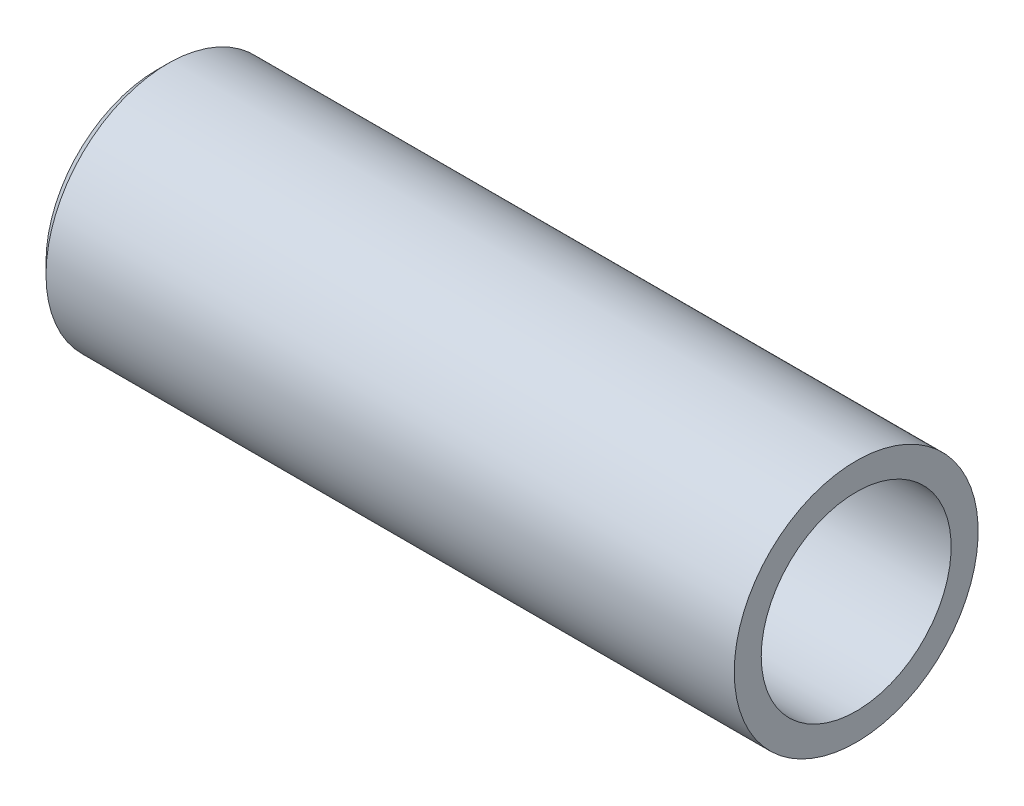
from build123d import *


with BuildPart() as part:
    # Sketch1 → Revolve1 (revolve)
    with BuildSketch(Plane.XY):
        Polygon((0.353306228, 5.422749886), (30.95625, 5.422749886), (30.95625, 4.22275), (-0.14375, 4.22275), (-0.14375, 4.925693658), align=None)
    revolve(axis=Axis((0, 0, 0), (1, 0, 0)))


solid = part.part
